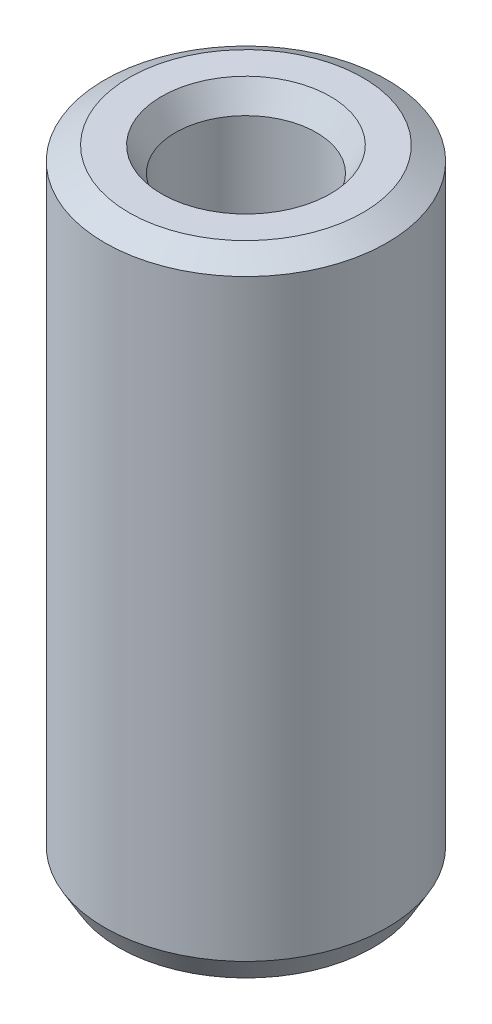
from build123d import *
from OCP.BRepFilletAPI import BRepFilletAPI_MakeChamfer

# Parameters (mm, degrees)
SKETCH1_R           = 12.5
BOSS_EXTRUDE1_DEPTH = 55.887348976
SKETCH2_R           = 6.234406443
CUT_EXTRUDE1_DEPTH  = 59.616514529
CHAMFER1_SIZE       = 1.239069715
CHAMFER1_SIZE2      = 2.146131701


with BuildPart() as part:
    # Sketch1 → Boss-Extrude1 (new body)
    with BuildSketch(Plane(origin=(0, 0, 0), x_dir=(1, 0, 0), z_dir=(0, 1, 0))):
        Circle(SKETCH1_R)
    extrude(amount=BOSS_EXTRUDE1_DEPTH)

    # Sketch2 → Cut-Extrude1 (cut, through all)
    with BuildSketch(Plane(origin=(0, 0, 0), x_dir=(1, 0, 0), z_dir=(0, 1, 0))):
        Circle(SKETCH2_R)
    extrude(amount=CUT_EXTRUDE1_DEPTH, mode=Mode.SUBTRACT)

    # Chamfer1: one chamfer whose edges measure the first distance from different faces: ONE call of the kernel's chamfer builder (chamfer() names one face for all edges)
    chamfer1_edges_1 = [part.edges().sort_by_distance(p)[0] for p in [
        (-6.234406443, 55.887348976, 0),
    ]]
    chamfer1_side_1 = [part.faces().sort_by_distance(p)[0] for p in [
        (-12.146446609, 55.887348976, 0),
    ]]
    chamfer1_edges_2 = [part.edges().sort_by_distance(p)[0] for p in [
        (-6.234406443, 0, 0),
    ]]
    chamfer1_side_2 = [part.faces().sort_by_distance(p)[0] for p in [
        (-6.234406443, 27.943674488, 0),
    ]]
    chamfer1_edges_3 = [part.edges().sort_by_distance(p)[0] for p in [
        (-12.5, 0, 0),
    ]]
    chamfer1_side_3 = [part.faces().sort_by_distance(p)[0] for p in [
        (-12.146446609, 0, 0),
    ]]
    chamfer1_edges_4 = [part.edges().sort_by_distance(p)[0] for p in [
        (-12.5, 55.887348976, 0),
    ]]
    chamfer1_side_4 = [part.faces().sort_by_distance(p)[0] for p in [
        (-12.5, 27.943674488, 0),
    ]]
    chamfer1 = BRepFilletAPI_MakeChamfer(part.part.solid().wrapped)
    for e in chamfer1_edges_1:
        chamfer1.Add(CHAMFER1_SIZE, CHAMFER1_SIZE2, e.wrapped, chamfer1_side_1[0].wrapped)  # the first distance lies on this face
    for e in chamfer1_edges_2:
        chamfer1.Add(CHAMFER1_SIZE, CHAMFER1_SIZE2, e.wrapped, chamfer1_side_2[0].wrapped)  # the first distance lies on this face
    for e in chamfer1_edges_3:
        chamfer1.Add(CHAMFER1_SIZE, CHAMFER1_SIZE2, e.wrapped, chamfer1_side_3[0].wrapped)  # the first distance lies on this face
    for e in chamfer1_edges_4:
        chamfer1.Add(CHAMFER1_SIZE, CHAMFER1_SIZE2, e.wrapped, chamfer1_side_4[0].wrapped)  # the first distance lies on this face
    add(Compound.cast(chamfer1.Shape()), mode=Mode.REPLACE)


solid = part.part
